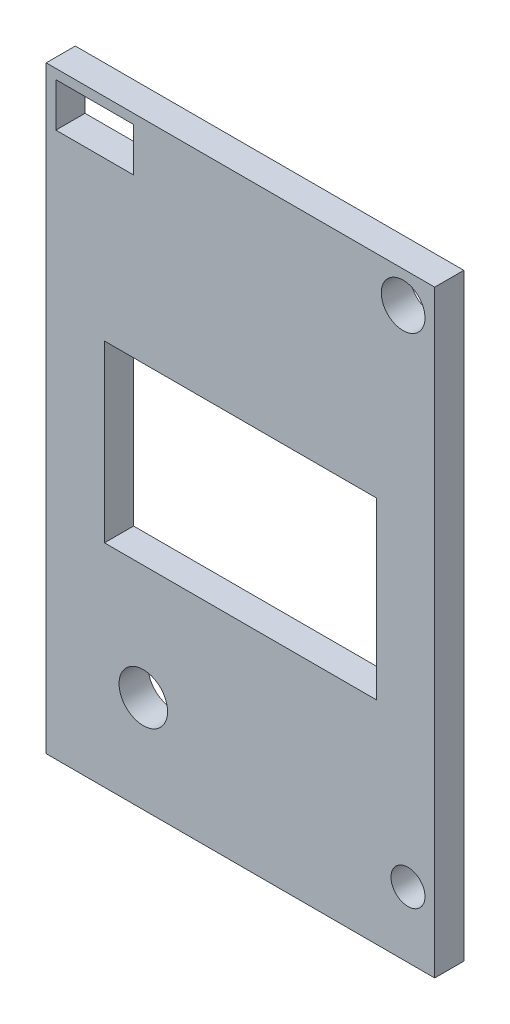
from build123d import *

# Parameters (mm, degrees)
SKETCH1_W           = 40
SKETCH1_H           = 61.6
SKETCH1_R           = 1.75
SKETCH1_R_2         = 2.25
SKETCH1_R_3         = 2.5
SKETCH1_W_2         = 8
SKETCH1_H_2         = 4.5
SKETCH1_W_3         = 28
SKETCH1_H_3         = 18
BOSS_EXTRUDE1_DEPTH = 3


with BuildPart() as part:
    # Sketch1 → Boss-Extrude1 (new body)
    with BuildSketch(Plane.XY):
        with Locations((20, 30.8)):
            Rectangle(SKETCH1_W, SKETCH1_H)
        with Locations((37.25, 6.75)):
            Circle(SKETCH1_R, mode=Mode.SUBTRACT)
        with Locations((36.75, 58.35)):
            Circle(SKETCH1_R_2, mode=Mode.SUBTRACT)
        with Locations((10, 10)):
            Circle(SKETCH1_R_3, mode=Mode.SUBTRACT)
        with Locations((5, 58.35)):
            Rectangle(SKETCH1_W_2, SKETCH1_H_2, mode=Mode.SUBTRACT)
        with Locations((20, 30.8)):
            Rectangle(SKETCH1_W_3, SKETCH1_H_3, mode=Mode.SUBTRACT)
    extrude(amount=BOSS_EXTRUDE1_DEPTH)


solid = part.part
